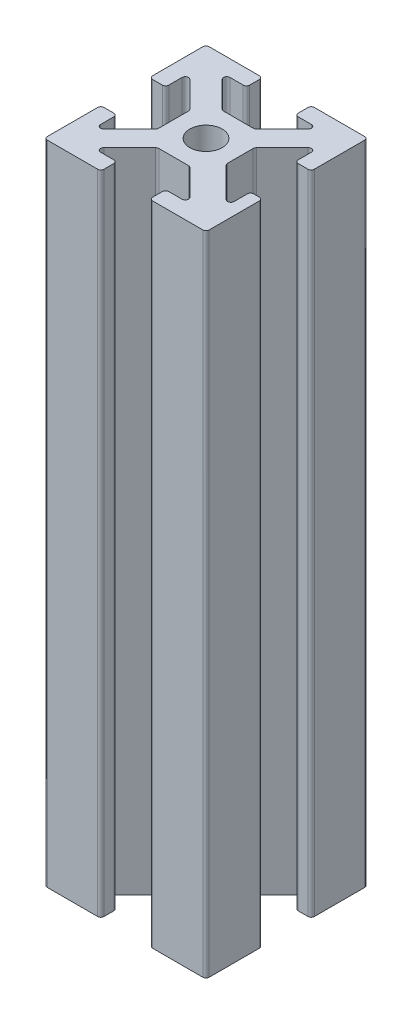
from build123d import *

# Parameters (mm, degrees)
ESQUISSE1_R        = 2
BOSS_EXTRU_1_DEPTH = 80
CONG_1_R           = 0.4


with BuildPart() as part:
    # Esquisse1 → Boss.-Extru.1 (new body)
    with BuildSketch(Plane(origin=(0, 0, 0), x_dir=(1, 0, 0), z_dir=(0, 1, 0))):
        Polygon((0, 0), (0, 7), (2, 7), (2, 4), (6, 8), (6, 12), (2, 16), (2, 13), (0, 13), (0, 20), (7, 20), (7, 18), (4, 18), (8, 14), (12, 14), (16, 18), (13, 18), (13, 20), (20, 20), (20, 13), (18, 13), (18, 16), (14, 12), (14, 8.5), (18.5, 4), (18.5, 7), (20, 7), (20, 0), (13, 0), (13, 2), (16, 2), (12, 6), (8, 6), (4, 2), (7, 2), (7, 0), align=None)
        with Locations((10, 10)):
            Circle(ESQUISSE1_R, mode=Mode.SUBTRACT)
    extrude(amount=BOSS_EXTRU_1_DEPTH)

    # Congé1
    cong_1_edges = [part.edges().sort_by_distance(p)[0] for p in [
        (4, 40, -18),
        (2, 40, -16),
        (6, 40, -12),
        (6, 40, -8),
        (2, 40, -4),
        (2, 40, -7),
        (0, 40, -7),
        (0, 40, 0),
        (7, 40, 0),
        (7, 40, -2),
        (4, 40, -2),
        (8, 40, -6),
        (12, 40, -6),
        (16, 40, -2),
        (13, 40, -2),
        (13, 40, 0),
        (20, 40, 0),
        (20, 40, -7),
        (18.5, 40, -7),
        (18.5, 40, -4),
        (14, 40, -8.5),
        (14, 40, -12),
        (18, 40, -16),
        (18, 40, -13),
        (20, 40, -13),
        (20, 40, -20),
        (13, 40, -20),
        (13, 40, -18),
        (16, 40, -18),
        (12, 40, -14),
        (8, 40, -14),
        (7, 40, -18),
        (7, 40, -20),
        (0, 40, -20),
        (0, 40, -13),
        (2, 40, -13),
    ]]
    fillet(cong_1_edges, radius=CONG_1_R)


solid = part.part
